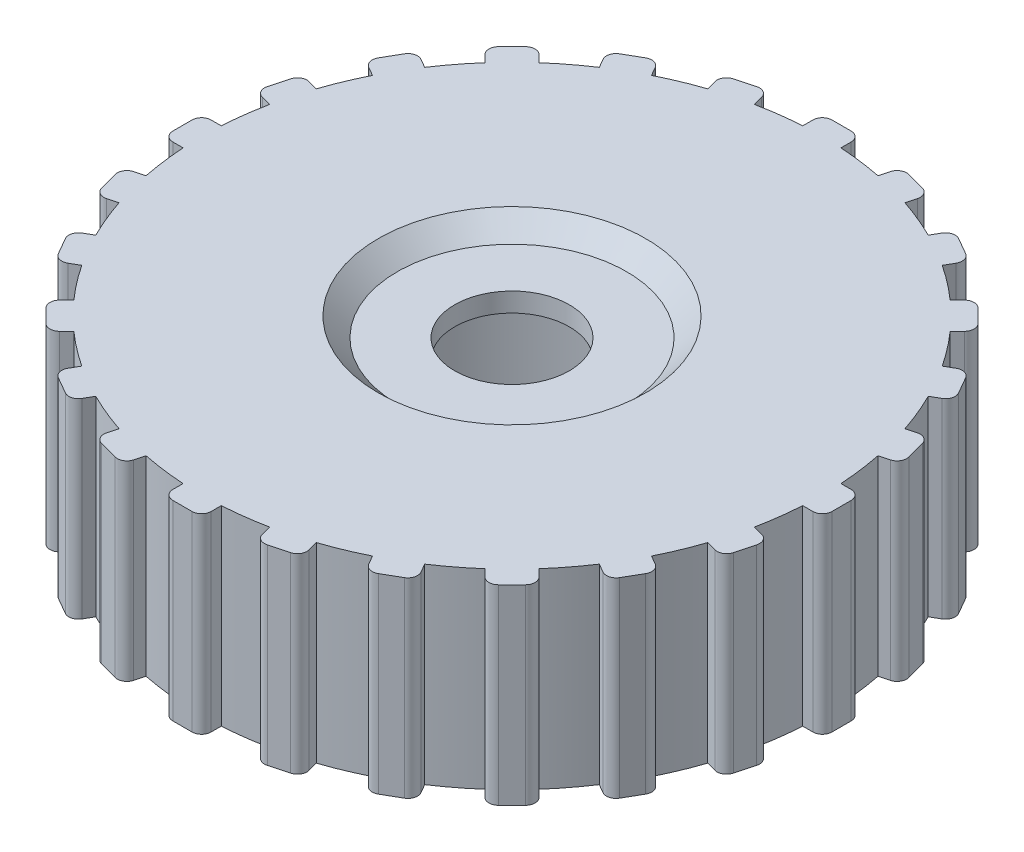
from build123d import *

# Parameters (mm, degrees)
SKETCH1_R           = 32.5
SKETCH1_R_2         = 18.5
BOSS_EXTRUDE1_DEPTH = 20
BOSS_EXTRUDE3_START = -20
BOSS_EXTRUDE3_DEPTH = 20
BOSS_EXTRUDE5_START = -20
BOSS_EXTRUDE5_DEPTH = 20
BOSS_EXTRUDE6_START = -4
SKETCH5_R           = 18.5
BOSS_EXTRUDE6_DEPTH = 4
SKETCH6_R           = 6
CUT_EXTRUDE1_DEPTH  = 4
SKETCH7_R           = 12
CUT_EXTRUDE2_DEPTH  = 2
CHAMFER1_SIZE       = 2


# Read off the part's stored shape, not the designer's step: Boss-Extrude5
with BuildPart() as part:
    # Sketch1 → Boss-Extrude1 (new body)
    with BuildSketch(Plane(origin=(0, 0, 0), x_dir=(1, 0, 0), z_dir=(0, 1, 0))):
        with Locations(Location((0, 0, 0), (0, 0, 270))):
            Circle(SKETCH1_R)
        with Locations(Location((0, 0, 0), (0, 0, 270))):
            Circle(SKETCH1_R_2, mode=Mode.SUBTRACT)
    extrude(amount=BOSS_EXTRUDE1_DEPTH)

    # Sketch3 → Boss-Extrude3 (add)
    with BuildSketch(Plane(origin=(0, 20, 0), x_dir=(1, 0, 0), z_dir=(0, 1, 0)).offset(BOSS_EXTRUDE3_START)):
        with BuildLine():
            ThreePointArc((1, 34.5), (1.707106781, 34.207106781), (2, 33.5))
            Line((2, 33.5), (2, 32.5))
            Line((2, 32.5), (0, 32.5))
            Line((0, 32.5), (-2, 32.5))
            Line((-2, 32.5), (-2, 33.5))
            ThreePointArc((-2, 33.5), (-1.707106781, 34.207106781), (-1, 34.5))
            Line((-1, 34.5), (1, 34.5))
        make_face()
        with BuildLine():
            ThreePointArc((2, 32.438403167), (1.000474159, 32.484597142), (0, 32.5))
            ThreePointArc((0, 32.5), (-1.000474159, 32.484597142), (-2, 32.438403167))
            Line((-2, 32.438403167), (-2, 31.779798794))
            Line((-2, 31.779798794), (2, 31.779798794))
            Line((2, 31.779798794), (2, 32.438403167))
        make_face()
        with BuildLine():
            Line((-6.293365525, 31.214566499), (-6.46382488, 31.850729472))
            ThreePointArc((-6.46382488, 31.850729472), (-7.441248584, 31.636653102), (-8.411618966, 31.392589354))
            ThreePointArc((-8.411618966, 31.392589354), (-9.374016241, 31.118769569), (-10.327528185, 30.815453292))
            Line((-10.327528185, 30.815453292), (-10.15706883, 30.179290319))
            Line((-10.15706883, 30.179290319), (-6.293365525, 31.214566499))
        make_face()
        with BuildLine():
            Line((-9.895182882, 33.065621962), (-7.96333123, 33.583260052))
            ThreePointArc((-7.96333123, 33.583260052), (-7.204512185, 33.48335963), (-6.738586358, 32.876153271))
            Line((-6.738586358, 32.876153271), (-6.479767313, 31.910227445))
            Line((-6.479767313, 31.910227445), (-8.411618966, 31.392589354))
            Line((-8.411618966, 31.392589354), (-10.343470618, 30.874951264))
            Line((-10.343470618, 30.874951264), (-10.602289664, 31.84087709))
            ThreePointArc((-10.602289664, 31.84087709), (-10.502389241, 32.599696136), (-9.895182882, 33.065621962))
        make_face()
        with BuildLine():
            ThreePointArc((8.411618966, 31.392589354), (7.441248584, 31.636653102), (6.46382488, 31.850729472))
            Line((6.46382488, 31.850729472), (6.293365525, 31.214566499))
            Line((6.293365525, 31.214566499), (10.15706883, 30.179290319))
            Line((10.15706883, 30.179290319), (10.327528185, 30.815453292))
            ThreePointArc((10.327528185, 30.815453292), (9.374016241, 31.118769569), (8.411618966, 31.392589354))
        make_face()
        with BuildLine():
            Line((7.96333123, 33.583260052), (9.895182882, 33.065621962))
            ThreePointArc((9.895182882, 33.065621962), (10.502389241, 32.599696136), (10.602289664, 31.84087709))
            Line((10.602289664, 31.84087709), (10.343470618, 30.874951264))
            Line((10.343470618, 30.874951264), (8.411618966, 31.392589354))
            Line((8.411618966, 31.392589354), (6.479767313, 31.910227445))
            Line((6.479767313, 31.910227445), (6.738586358, 32.876153271))
            ThreePointArc((6.738586358, 32.876153271), (7.204512185, 33.48335963), (7.96333123, 33.583260052))
        make_face()
        with BuildLine():
            ThreePointArc((16.25, 28.145825623), (15.375862533, 28.632723436), (14.487150776, 29.0924812))
            Line((14.487150776, 29.0924812), (14.157848589, 28.522113082))
            Line((14.157848589, 28.522113082), (17.621950204, 26.522113082))
            Line((17.621950204, 26.522113082), (17.951252391, 27.0924812))
            ThreePointArc((17.951252391, 27.0924812), (17.108734608, 27.632249277), (16.25, 28.145825623))
        make_face()
        with BuildLine():
            Line((16.383974596, 30.377876431), (18.116025404, 29.377876431))
            ThreePointArc((18.116025404, 29.377876431), (18.58195123, 28.770670072), (18.482050808, 28.011851027))
            Line((18.482050808, 28.011851027), (17.982050808, 27.145825623))
            Line((17.982050808, 27.145825623), (16.25, 28.145825623))
            Line((16.25, 28.145825623), (14.517949192, 29.145825623))
            Line((14.517949192, 29.145825623), (15.017949192, 30.011851027))
            ThreePointArc((15.017949192, 30.011851027), (15.625155551, 30.477776853), (16.383974596, 30.377876431))
        make_face()
        with BuildLine():
            ThreePointArc((22.980970389, 22.980970389), (22.262636861, 23.677520985), (21.523201288, 24.351628412))
            Line((21.523201288, 24.351628412), (21.057497669, 23.885924794))
            Line((21.057497669, 23.885924794), (23.885924794, 21.057497669))
            Line((23.885924794, 21.057497669), (24.351628412, 21.523201288))
            ThreePointArc((24.351628412, 21.523201288), (23.677520985, 22.262636861), (22.980970389, 22.980970389))
        make_face()
        with BuildLine():
            Line((23.68807717, 25.102290732), (25.102290732, 23.68807717))
            ThreePointArc((25.102290732, 23.68807717), (25.395183951, 22.980970389), (25.102290732, 22.273863607))
            Line((25.102290732, 22.273863607), (24.395183951, 21.566756826))
            Line((24.395183951, 21.566756826), (22.980970389, 22.980970389))
            Line((22.980970389, 22.980970389), (21.566756826, 24.395183951))
            Line((21.566756826, 24.395183951), (22.273863607, 25.102290732))
            ThreePointArc((22.273863607, 25.102290732), (22.980970389, 25.395183951), (23.68807717, 25.102290732))
        make_face()
        with BuildLine():
            Line((-14.157848589, 28.522113082), (-14.487150776, 29.0924812))
            ThreePointArc((-14.487150776, 29.0924812), (-15.375862533, 28.632723436), (-16.25, 28.145825623))
            ThreePointArc((-16.25, 28.145825623), (-17.108734608, 27.632249277), (-17.951252391, 27.0924812))
            Line((-17.951252391, 27.0924812), (-17.621950204, 26.522113082))
            Line((-17.621950204, 26.522113082), (-14.157848589, 28.522113082))
        make_face()
        with BuildLine():
            Line((-18.116025404, 29.377876431), (-16.383974596, 30.377876431))
            ThreePointArc((-16.383974596, 30.377876431), (-15.625155551, 30.477776853), (-15.017949192, 30.011851027))
            Line((-15.017949192, 30.011851027), (-14.517949192, 29.145825623))
            Line((-14.517949192, 29.145825623), (-16.25, 28.145825623))
            Line((-16.25, 28.145825623), (-17.982050808, 27.145825623))
            Line((-17.982050808, 27.145825623), (-18.482050808, 28.011851027))
            ThreePointArc((-18.482050808, 28.011851027), (-18.58195123, 28.770670072), (-18.116025404, 29.377876431))
        make_face()
        with BuildLine():
            Line((-21.057497669, 23.885924794), (-21.523201288, 24.351628412))
            ThreePointArc((-21.523201288, 24.351628412), (-22.262636861, 23.677520985), (-22.980970389, 22.980970389))
            ThreePointArc((-22.980970389, 22.980970389), (-23.677520985, 22.262636861), (-24.351628412, 21.523201288))
            Line((-24.351628412, 21.523201288), (-23.885924794, 21.057497669))
            Line((-23.885924794, 21.057497669), (-21.057497669, 23.885924794))
        make_face()
        with BuildLine():
            Line((-25.102290732, 23.68807717), (-23.68807717, 25.102290732))
            ThreePointArc((-23.68807717, 25.102290732), (-22.980970389, 25.395183951), (-22.273863607, 25.102290732))
            Line((-22.273863607, 25.102290732), (-21.566756826, 24.395183951))
            Line((-21.566756826, 24.395183951), (-22.980970389, 22.980970389))
            Line((-22.980970389, 22.980970389), (-24.395183951, 21.566756826))
            Line((-24.395183951, 21.566756826), (-25.102290732, 22.273863607))
            ThreePointArc((-25.102290732, 22.273863607), (-25.395183951, 22.980970389), (-25.102290732, 23.68807717))
        make_face()
        with BuildLine():
            Line((-26.522113082, 17.621950204), (-27.0924812, 17.951252391))
            ThreePointArc((-27.0924812, 17.951252391), (-27.632249277, 17.108734608), (-28.145825623, 16.25))
            ThreePointArc((-28.145825623, 16.25), (-28.632723436, 15.375862533), (-29.0924812, 14.487150776))
            Line((-29.0924812, 14.487150776), (-28.522113082, 14.157848589))
            Line((-28.522113082, 14.157848589), (-26.522113082, 17.621950204))
        make_face()
        with BuildLine():
            Line((-30.377876431, 16.383974596), (-29.377876431, 18.116025404))
            ThreePointArc((-29.377876431, 18.116025404), (-28.770670072, 18.58195123), (-28.011851027, 18.482050808))
            Line((-28.011851027, 18.482050808), (-27.145825623, 17.982050808))
            Line((-27.145825623, 17.982050808), (-28.145825623, 16.25))
            Line((-28.145825623, 16.25), (-29.145825623, 14.517949192))
            Line((-29.145825623, 14.517949192), (-30.011851027, 15.017949192))
            ThreePointArc((-30.011851027, 15.017949192), (-30.477776853, 15.625155551), (-30.377876431, 16.383974596))
        make_face()
        with BuildLine():
            Line((-30.179290319, 10.15706883), (-30.815453292, 10.327528185))
            ThreePointArc((-30.815453292, 10.327528185), (-31.118769569, 9.374016241), (-31.392589354, 8.411618966))
            ThreePointArc((-31.392589354, 8.411618966), (-31.636653102, 7.441248584), (-31.850729472, 6.46382488))
            Line((-31.850729472, 6.46382488), (-31.214566499, 6.293365525))
            Line((-31.214566499, 6.293365525), (-30.179290319, 10.15706883))
        make_face()
        with BuildLine():
            Line((-33.583260052, 7.96333123), (-33.065621962, 9.895182882))
            ThreePointArc((-33.065621962, 9.895182882), (-32.599696136, 10.502389241), (-31.84087709, 10.602289664))
            Line((-31.84087709, 10.602289664), (-30.874951264, 10.343470618))
            Line((-30.874951264, 10.343470618), (-31.392589354, 8.411618966))
            Line((-31.392589354, 8.411618966), (-31.910227445, 6.479767313))
            Line((-31.910227445, 6.479767313), (-32.876153271, 6.738586358))
            ThreePointArc((-32.876153271, 6.738586358), (-33.48335963, 7.204512185), (-33.583260052, 7.96333123))
        make_face()
        with BuildLine():
            Line((-34.5, -1), (-34.5, 1))
            ThreePointArc((-34.5, 1), (-34.207106781, 1.707106781), (-33.5, 2))
            Line((-33.5, 2), (-32.5, 2))
            Line((-32.5, 2), (-32.5, 0))
            Line((-32.5, 0), (-32.5, -2))
            Line((-32.5, -2), (-33.5, -2))
            ThreePointArc((-33.5, -2), (-34.207106781, -1.707106781), (-34.5, -1))
        make_face()
        with BuildLine():
            Line((-31.779798794, 2), (-32.438403167, 2))
            ThreePointArc((-32.438403167, 2), (-32.484597142, 1.000474159), (-32.5, 0))
            ThreePointArc((-32.5, 0), (-32.484597142, -1.000474159), (-32.438403167, -2))
            Line((-32.438403167, -2), (-31.779798794, -2))
            Line((-31.779798794, -2), (-31.779798794, 2))
        make_face()
        with BuildLine():
            Line((-33.065621962, -9.895182882), (-33.583260052, -7.96333123))
            ThreePointArc((-33.583260052, -7.96333123), (-33.48335963, -7.204512185), (-32.876153271, -6.738586358))
            Line((-32.876153271, -6.738586358), (-31.910227445, -6.479767313))
            Line((-31.910227445, -6.479767313), (-31.392589354, -8.411618966))
            Line((-31.392589354, -8.411618966), (-30.874951264, -10.343470618))
            Line((-30.874951264, -10.343470618), (-31.84087709, -10.602289664))
            ThreePointArc((-31.84087709, -10.602289664), (-32.599696136, -10.502389241), (-33.065621962, -9.895182882))
        make_face()
        with BuildLine():
            Line((-31.214566499, -6.293365525), (-31.850729472, -6.46382488))
            ThreePointArc((-31.850729472, -6.46382488), (-31.636653102, -7.441248584), (-31.392589354, -8.411618966))
            ThreePointArc((-31.392589354, -8.411618966), (-31.118769569, -9.374016241), (-30.815453292, -10.327528185))
            Line((-30.815453292, -10.327528185), (-30.179290319, -10.15706883))
            Line((-30.179290319, -10.15706883), (-31.214566499, -6.293365525))
        make_face()
        with BuildLine():
            Line((-29.377876431, -18.116025404), (-30.377876431, -16.383974596))
            ThreePointArc((-30.377876431, -16.383974596), (-30.477776853, -15.625155551), (-30.011851027, -15.017949192))
            Line((-30.011851027, -15.017949192), (-29.145825623, -14.517949192))
            Line((-29.145825623, -14.517949192), (-28.145825623, -16.25))
            Line((-28.145825623, -16.25), (-27.145825623, -17.982050808))
            Line((-27.145825623, -17.982050808), (-28.011851027, -18.482050808))
            ThreePointArc((-28.011851027, -18.482050808), (-28.770670072, -18.58195123), (-29.377876431, -18.116025404))
        make_face()
        with BuildLine():
            Line((-28.522113082, -14.157848589), (-29.0924812, -14.487150776))
            ThreePointArc((-29.0924812, -14.487150776), (-28.632723436, -15.375862533), (-28.145825623, -16.25))
            ThreePointArc((-28.145825623, -16.25), (-27.632249277, -17.108734608), (-27.0924812, -17.951252391))
            Line((-27.0924812, -17.951252391), (-26.522113082, -17.621950204))
            Line((-26.522113082, -17.621950204), (-28.522113082, -14.157848589))
        make_face()
        with BuildLine():
            Line((-23.68807717, -25.102290732), (-25.102290732, -23.68807717))
            ThreePointArc((-25.102290732, -23.68807717), (-25.395183951, -22.980970389), (-25.102290732, -22.273863607))
            Line((-25.102290732, -22.273863607), (-24.395183951, -21.566756826))
            Line((-24.395183951, -21.566756826), (-22.980970389, -22.980970389))
            Line((-22.980970389, -22.980970389), (-21.566756826, -24.395183951))
            Line((-21.566756826, -24.395183951), (-22.273863607, -25.102290732))
            ThreePointArc((-22.273863607, -25.102290732), (-22.980970389, -25.395183951), (-23.68807717, -25.102290732))
        make_face()
        with BuildLine():
            Line((-23.885924794, -21.057497669), (-24.351628412, -21.523201288))
            ThreePointArc((-24.351628412, -21.523201288), (-23.677520985, -22.262636861), (-22.980970389, -22.980970389))
            ThreePointArc((-22.980970389, -22.980970389), (-22.262636861, -23.677520985), (-21.523201288, -24.351628412))
            Line((-21.523201288, -24.351628412), (-21.057497669, -23.885924794))
            Line((-21.057497669, -23.885924794), (-23.885924794, -21.057497669))
        make_face()
        with BuildLine():
            Line((-16.383974596, -30.377876431), (-18.116025404, -29.377876431))
            ThreePointArc((-18.116025404, -29.377876431), (-18.58195123, -28.770670072), (-18.482050808, -28.011851027))
            Line((-18.482050808, -28.011851027), (-17.982050808, -27.145825623))
            Line((-17.982050808, -27.145825623), (-16.25, -28.145825623))
            Line((-16.25, -28.145825623), (-14.517949192, -29.145825623))
            Line((-14.517949192, -29.145825623), (-15.017949192, -30.011851027))
            ThreePointArc((-15.017949192, -30.011851027), (-15.625155551, -30.477776853), (-16.383974596, -30.377876431))
        make_face()
        with BuildLine():
            Line((-17.621950204, -26.522113082), (-17.951252391, -27.0924812))
            ThreePointArc((-17.951252391, -27.0924812), (-17.108734608, -27.632249277), (-16.25, -28.145825623))
            ThreePointArc((-16.25, -28.145825623), (-15.375862533, -28.632723436), (-14.487150776, -29.0924812))
            Line((-14.487150776, -29.0924812), (-14.157848589, -28.522113082))
            Line((-14.157848589, -28.522113082), (-17.621950204, -26.522113082))
        make_face()
        with BuildLine():
            Line((-10.15706883, -30.179290319), (-10.327528185, -30.815453292))
            ThreePointArc((-10.327528185, -30.815453292), (-9.374016241, -31.118769569), (-8.411618966, -31.392589354))
            ThreePointArc((-8.411618966, -31.392589354), (-7.441248584, -31.636653102), (-6.46382488, -31.850729472))
            Line((-6.46382488, -31.850729472), (-6.293365525, -31.214566499))
            Line((-6.293365525, -31.214566499), (-10.15706883, -30.179290319))
        make_face()
        with BuildLine():
            Line((1, -34.5), (-1, -34.5))
            ThreePointArc((-1, -34.5), (-1.707106781, -34.207106781), (-2, -33.5))
            Line((-2, -33.5), (-2, -32.5))
            Line((-2, -32.5), (0, -32.5))
            Line((0, -32.5), (2, -32.5))
            Line((2, -32.5), (2, -33.5))
            ThreePointArc((2, -33.5), (1.707106781, -34.207106781), (1, -34.5))
        make_face()
        with BuildLine():
            ThreePointArc((0, -32.5), (1.000474159, -32.484597142), (2, -32.438403167))
            Line((2, -32.438403167), (2, -31.779798794))
            Line((2, -31.779798794), (-2, -31.779798794))
            Line((-2, -31.779798794), (-2, -32.438403167))
            ThreePointArc((-2, -32.438403167), (-1.000474159, -32.484597142), (0, -32.5))
        make_face()
        with BuildLine():
            Line((9.895182882, -33.065621962), (7.96333123, -33.583260052))
            ThreePointArc((7.96333123, -33.583260052), (7.204512185, -33.48335963), (6.738586358, -32.876153271))
            Line((6.738586358, -32.876153271), (6.479767313, -31.910227445))
            Line((6.479767313, -31.910227445), (8.411618966, -31.392589354))
            Line((8.411618966, -31.392589354), (10.343470618, -30.874951264))
            Line((10.343470618, -30.874951264), (10.602289664, -31.84087709))
            ThreePointArc((10.602289664, -31.84087709), (10.502389241, -32.599696136), (9.895182882, -33.065621962))
        make_face()
        with BuildLine():
            ThreePointArc((8.411618966, -31.392589354), (9.374016241, -31.118769569), (10.327528185, -30.815453292))
            Line((10.327528185, -30.815453292), (10.15706883, -30.179290319))
            Line((10.15706883, -30.179290319), (6.293365525, -31.214566499))
            Line((6.293365525, -31.214566499), (6.46382488, -31.850729472))
            ThreePointArc((6.46382488, -31.850729472), (7.441248584, -31.636653102), (8.411618966, -31.392589354))
        make_face()
        with BuildLine():
            Line((18.116025404, -29.377876431), (16.383974596, -30.377876431))
            ThreePointArc((16.383974596, -30.377876431), (15.625155551, -30.477776853), (15.017949192, -30.011851027))
            Line((15.017949192, -30.011851027), (14.517949192, -29.145825623))
            Line((14.517949192, -29.145825623), (16.25, -28.145825623))
            Line((16.25, -28.145825623), (17.982050808, -27.145825623))
            Line((17.982050808, -27.145825623), (18.482050808, -28.011851027))
            ThreePointArc((18.482050808, -28.011851027), (18.58195123, -28.770670072), (18.116025404, -29.377876431))
        make_face()
        with BuildLine():
            ThreePointArc((16.25, -28.145825623), (17.108734608, -27.632249277), (17.951252391, -27.0924812))
            Line((17.951252391, -27.0924812), (17.621950204, -26.522113082))
            Line((17.621950204, -26.522113082), (14.157848589, -28.522113082))
            Line((14.157848589, -28.522113082), (14.487150776, -29.0924812))
            ThreePointArc((14.487150776, -29.0924812), (15.375862533, -28.632723436), (16.25, -28.145825623))
        make_face()
        with BuildLine():
            Line((25.102290732, -23.68807717), (23.68807717, -25.102290732))
            ThreePointArc((23.68807717, -25.102290732), (22.980970389, -25.395183951), (22.273863607, -25.102290732))
            Line((22.273863607, -25.102290732), (21.566756826, -24.395183951))
            Line((21.566756826, -24.395183951), (22.980970389, -22.980970389))
            Line((22.980970389, -22.980970389), (24.395183951, -21.566756826))
            Line((24.395183951, -21.566756826), (25.102290732, -22.273863607))
            ThreePointArc((25.102290732, -22.273863607), (25.395183951, -22.980970389), (25.102290732, -23.68807717))
        make_face()
        with BuildLine():
            ThreePointArc((22.980970389, -22.980970389), (23.677520985, -22.262636861), (24.351628412, -21.523201288))
            Line((24.351628412, -21.523201288), (23.885924794, -21.057497669))
            Line((23.885924794, -21.057497669), (21.057497669, -23.885924794))
            Line((21.057497669, -23.885924794), (21.523201288, -24.351628412))
            ThreePointArc((21.523201288, -24.351628412), (22.262636861, -23.677520985), (22.980970389, -22.980970389))
        make_face()
        with BuildLine():
            Line((30.377876431, -16.383974596), (29.377876431, -18.116025404))
            ThreePointArc((29.377876431, -18.116025404), (28.770670072, -18.58195123), (28.011851027, -18.482050808))
            Line((28.011851027, -18.482050808), (27.145825623, -17.982050808))
            Line((27.145825623, -17.982050808), (28.145825623, -16.25))
            Line((28.145825623, -16.25), (29.145825623, -14.517949192))
            Line((29.145825623, -14.517949192), (30.011851027, -15.017949192))
            ThreePointArc((30.011851027, -15.017949192), (30.477776853, -15.625155551), (30.377876431, -16.383974596))
        make_face()
        with BuildLine():
            ThreePointArc((28.145825623, -16.25), (28.632723436, -15.375862533), (29.0924812, -14.487150776))
            Line((29.0924812, -14.487150776), (28.522113082, -14.157848589))
            Line((28.522113082, -14.157848589), (26.522113082, -17.621950204))
            Line((26.522113082, -17.621950204), (27.0924812, -17.951252391))
            ThreePointArc((27.0924812, -17.951252391), (27.632249277, -17.108734608), (28.145825623, -16.25))
        make_face()
        with BuildLine():
            Line((33.583260052, -7.96333123), (33.065621962, -9.895182882))
            ThreePointArc((33.065621962, -9.895182882), (32.599696136, -10.502389241), (31.84087709, -10.602289664))
            Line((31.84087709, -10.602289664), (30.874951264, -10.343470618))
            Line((30.874951264, -10.343470618), (31.392589354, -8.411618966))
            Line((31.392589354, -8.411618966), (31.910227445, -6.479767313))
            Line((31.910227445, -6.479767313), (32.876153271, -6.738586358))
            ThreePointArc((32.876153271, -6.738586358), (33.48335963, -7.204512185), (33.583260052, -7.96333123))
        make_face()
        with BuildLine():
            ThreePointArc((31.392589354, -8.411618966), (31.636653102, -7.441248584), (31.850729472, -6.46382488))
            Line((31.850729472, -6.46382488), (31.214566499, -6.293365525))
            Line((31.214566499, -6.293365525), (30.179290319, -10.15706883))
            Line((30.179290319, -10.15706883), (30.815453292, -10.327528185))
            ThreePointArc((30.815453292, -10.327528185), (31.118769569, -9.374016241), (31.392589354, -8.411618966))
        make_face()
        with BuildLine():
            Line((34.5, 1), (34.5, -1))
            ThreePointArc((34.5, -1), (34.207106781, -1.707106781), (33.5, -2))
            Line((33.5, -2), (32.5, -2))
            Line((32.5, -2), (32.5, 0))
            Line((32.5, 0), (32.5, 2))
            Line((32.5, 2), (33.5, 2))
            ThreePointArc((33.5, 2), (34.207106781, 1.707106781), (34.5, 1))
        make_face()
        with BuildLine():
            ThreePointArc((32.5, 0), (32.484597142, 1.000474159), (32.438403167, 2))
            Line((32.438403167, 2), (31.779798794, 2))
            Line((31.779798794, 2), (31.779798794, -2))
            Line((31.779798794, -2), (32.438403167, -2))
            ThreePointArc((32.438403167, -2), (32.484597142, -1.000474159), (32.5, 0))
        make_face()
        with BuildLine():
            Line((33.065621962, 9.895182882), (33.583260052, 7.96333123))
            ThreePointArc((33.583260052, 7.96333123), (33.48335963, 7.204512185), (32.876153271, 6.738586358))
            Line((32.876153271, 6.738586358), (31.910227445, 6.479767313))
            Line((31.910227445, 6.479767313), (31.392589354, 8.411618966))
            Line((31.392589354, 8.411618966), (30.874951264, 10.343470618))
            Line((30.874951264, 10.343470618), (31.84087709, 10.602289664))
            ThreePointArc((31.84087709, 10.602289664), (32.599696136, 10.502389241), (33.065621962, 9.895182882))
        make_face()
        with BuildLine():
            ThreePointArc((31.392589354, 8.411618966), (31.118769569, 9.374016241), (30.815453292, 10.327528185))
            Line((30.815453292, 10.327528185), (30.179290319, 10.15706883))
            Line((30.179290319, 10.15706883), (31.214566499, 6.293365525))
            Line((31.214566499, 6.293365525), (31.850729472, 6.46382488))
            ThreePointArc((31.850729472, 6.46382488), (31.636653102, 7.441248584), (31.392589354, 8.411618966))
        make_face()
        with BuildLine():
            Line((29.377876431, 18.116025404), (30.377876431, 16.383974596))
            ThreePointArc((30.377876431, 16.383974596), (30.477776853, 15.625155551), (30.011851027, 15.017949192))
            Line((30.011851027, 15.017949192), (29.145825623, 14.517949192))
            Line((29.145825623, 14.517949192), (28.145825623, 16.25))
            Line((28.145825623, 16.25), (27.145825623, 17.982050808))
            Line((27.145825623, 17.982050808), (28.011851027, 18.482050808))
            ThreePointArc((28.011851027, 18.482050808), (28.770670072, 18.58195123), (29.377876431, 18.116025404))
        make_face()
        with BuildLine():
            ThreePointArc((28.145825623, 16.25), (27.632249277, 17.108734608), (27.0924812, 17.951252391))
            Line((27.0924812, 17.951252391), (26.522113082, 17.621950204))
            Line((26.522113082, 17.621950204), (28.522113082, 14.157848589))
            Line((28.522113082, 14.157848589), (29.0924812, 14.487150776))
            ThreePointArc((29.0924812, 14.487150776), (28.632723436, 15.375862533), (28.145825623, 16.25))
        make_face()
        with BuildLine():
            Line((-7.96333123, -33.583260052), (-9.895182882, -33.065621962))
            ThreePointArc((-9.895182882, -33.065621962), (-10.502389241, -32.599696136), (-10.602289664, -31.84087709))
            Line((-10.602289664, -31.84087709), (-10.343470618, -30.874951264))
            Line((-10.343470618, -30.874951264), (-8.411618966, -31.392589354))
            Line((-8.411618966, -31.392589354), (-6.479767313, -31.910227445))
            Line((-6.479767313, -31.910227445), (-6.738586358, -32.876153271))
            ThreePointArc((-6.738586358, -32.876153271), (-7.204512185, -33.48335963), (-7.96333123, -33.583260052))
        make_face()
    extrude(amount=BOSS_EXTRUDE3_DEPTH)

    # Boss-Extrude5 outline → Boss-Extrude5 (add)
    with BuildSketch(Plane(origin=(0, 20, 0), x_dir=(1, 0, 0), z_dir=(0, 1, 0)).offset(BOSS_EXTRUDE5_START)):
        with BuildLine():
            Line((32.5, -2), (32.5, 0))
            ThreePointArc((32.5, 0), (32.484597142, -1.000474159), (32.438403167, -2))
            Line((32.438403167, -2), (32.5, -2))
        make_face()
        with BuildLine():
            ThreePointArc((32.438403167, 2), (32.484597142, 1.000474159), (32.5, 0))
            Line((32.5, 0), (32.5, 2))
            Line((32.5, 2), (32.438403167, 2))
        make_face()
        with BuildLine():
            ThreePointArc((31.392589406, 8.411618773), (31.636653125, 7.441248487), (31.850729472, 6.46382488))
            Line((31.850729472, 6.46382488), (31.910227445, 6.479767314))
            Line((31.910227445, 6.479767314), (31.392589406, 8.411618773))
        make_face()
        with BuildLine():
            Line((31.910227445, -6.479767314), (31.850729472, -6.46382488))
            ThreePointArc((31.850729472, -6.46382488), (31.636653096, -7.44124861), (31.392589341, -8.411619017))
            Line((31.392589341, -8.411619017), (31.910227445, -6.479767314))
        make_face()
        with BuildLine():
            ThreePointArc((30.815453292, 10.327528185), (31.118769598, 9.374016146), (31.392589406, 8.411618773))
            Line((31.392589406, 8.411618773), (30.874951264, 10.343470618))
            Line((30.874951264, 10.343470618), (30.815453292, 10.327528185))
        make_face()
        with BuildLine():
            Line((30.874951264, -10.343470618), (31.392589341, -8.411619017))
            ThreePointArc((31.392589341, -8.411619017), (31.118769562, -9.374016267), (30.815453292, -10.327528185))
            Line((30.815453292, -10.327528185), (30.874951264, -10.343470618))
        make_face()
        with BuildLine():
            ThreePointArc((28.145825549, 16.250000127), (28.632723401, 15.375862598), (29.0924812, 14.487150776))
            Line((29.0924812, 14.487150776), (29.145825623, 14.517949193))
            Line((29.145825623, 14.517949193), (28.145825549, 16.250000127))
        make_face()
        with BuildLine():
            Line((29.145825623, -14.517949193), (29.0924812, -14.487150776))
            ThreePointArc((29.0924812, -14.487150776), (28.632723353, -15.375862687), (28.145825449, -16.250000301))
            Line((28.145825449, -16.250000301), (29.145825623, -14.517949193))
        make_face()
        with BuildLine():
            ThreePointArc((27.0924812, 17.951252391), (27.632249238, 17.108734671), (28.145825549, 16.250000127))
            Line((28.145825549, 16.250000127), (27.145825623, 17.982050808))
            Line((27.145825623, 17.982050808), (27.0924812, 17.951252391))
        make_face()
        with BuildLine():
            Line((27.145825623, -17.982050808), (28.145825449, -16.250000301))
            ThreePointArc((28.145825449, -16.250000301), (27.632249185, -17.108734756), (27.0924812, -17.951252391))
            Line((27.0924812, -17.951252391), (27.145825623, -17.982050808))
        make_face()
        with BuildLine():
            ThreePointArc((22.980970389, 22.980970388), (23.677520985, 22.262636861), (24.351628412, 21.523201288))
            Line((24.351628412, 21.523201288), (24.395183951, 21.566756826))
            Line((24.395183951, 21.566756826), (22.980970389, 22.980970388))
        make_face()
        with BuildLine():
            Line((24.395183951, -21.566756826), (24.351628412, -21.523201288))
            ThreePointArc((24.351628412, -21.523201288), (23.677520985, -22.262636861), (22.980970388, -22.980970389))
            Line((22.980970388, -22.980970389), (24.395183951, -21.566756826))
        make_face()
        with BuildLine():
            ThreePointArc((21.523201288, 24.351628412), (22.262636861, 23.677520985), (22.980970389, 22.980970388))
            Line((22.980970389, 22.980970388), (21.566756826, 24.395183951))
            Line((21.566756826, 24.395183951), (21.523201288, 24.351628412))
        make_face()
        with BuildLine():
            Line((21.566756826, -24.395183951), (22.980970388, -22.980970389))
            ThreePointArc((22.980970388, -22.980970389), (22.262636861, -23.677520985), (21.523201288, -24.351628412))
            Line((21.523201288, -24.351628412), (21.566756826, -24.395183951))
        make_face()
        with BuildLine():
            ThreePointArc((16.250000127, 28.145825549), (17.108734671, 27.632249238), (17.951252391, 27.0924812))
            Line((17.951252391, 27.0924812), (17.982050808, 27.145825623))
            Line((17.982050808, 27.145825623), (16.250000127, 28.145825549))
        make_face()
        with BuildLine():
            Line((17.982050808, -27.145825623), (17.951252391, -27.0924812))
            ThreePointArc((17.951252391, -27.0924812), (17.108734671, -27.632249238), (16.250000127, -28.145825549))
            Line((16.250000127, -28.145825549), (17.982050808, -27.145825623))
        make_face()
        with BuildLine():
            ThreePointArc((14.487150776, 29.0924812), (15.375862598, 28.632723401), (16.250000127, 28.145825549))
            Line((16.250000127, 28.145825549), (14.517949192, 29.145825623))
            Line((14.517949192, 29.145825623), (14.487150776, 29.0924812))
        make_face()
        with BuildLine():
            Line((14.517949192, -29.145825623), (16.250000127, -28.145825549))
            ThreePointArc((16.250000127, -28.145825549), (15.375862598, -28.632723401), (14.487150776, -29.0924812))
            Line((14.487150776, -29.0924812), (14.517949192, -29.145825623))
        make_face()
        with BuildLine():
            ThreePointArc((8.41161876, 31.39258941), (9.374016139, 31.1187696), (10.327528185, 30.815453292))
            Line((10.327528185, 30.815453292), (10.343470619, 30.874951264))
            Line((10.343470619, 30.874951264), (8.41161876, 31.39258941))
        make_face()
        with BuildLine():
            Line((10.343470619, -30.874951264), (10.327528185, -30.815453292))
            ThreePointArc((10.327528185, -30.815453292), (9.374016341, -31.118769539), (8.411619167, -31.3925893))
            Line((8.411619167, -31.3925893), (10.343470619, -30.874951264))
        make_face()
        with BuildLine():
            ThreePointArc((6.46382488, 31.850729472), (7.441248481, 31.636653127), (8.41161876, 31.39258941))
            Line((8.41161876, 31.39258941), (6.479767313, 31.910227445))
            Line((6.479767313, 31.910227445), (6.46382488, 31.850729472))
        make_face()
        with BuildLine():
            Line((6.479767313, -31.910227445), (8.411619167, -31.3925893))
            ThreePointArc((8.411619167, -31.3925893), (7.441248686, -31.636653078), (6.46382488, -31.850729472))
            Line((6.46382488, -31.850729472), (6.479767313, -31.910227445))
        make_face()
        with BuildLine():
            ThreePointArc((0, 32.5), (1.000474159, 32.484597142), (2, 32.438403167))
            Line((2, 32.438403167), (2, 32.5))
            Line((2, 32.5), (0, 32.5))
        make_face()
        with BuildLine():
            Line((2, -32.5), (2, -32.438403167))
            ThreePointArc((2, -32.438403167), (1.000474159, -32.484597142), (0, -32.5))
            Line((0, -32.5), (2, -32.5))
        make_face()
        with BuildLine():
            ThreePointArc((-2, 32.438403167), (-1.000474159, 32.484597142), (0, 32.5))
            Line((0, 32.5), (-2, 32.5))
            Line((-2, 32.5), (-2, 32.438403167))
        make_face()
        with BuildLine():
            Line((-2, -32.5), (0, -32.5))
            ThreePointArc((0, -32.5), (-1.000474159, -32.484597142), (-2, -32.438403167))
            Line((-2, -32.438403167), (-2, -32.5))
        make_face()
        with BuildLine():
            ThreePointArc((-8.411619167, 31.3925893), (-7.441248686, 31.636653078), (-6.46382488, 31.850729472))
            Line((-6.46382488, 31.850729472), (-6.479767314, 31.910227445))
            Line((-6.479767314, 31.910227445), (-8.411619167, 31.3925893))
        make_face()
        with BuildLine():
            Line((-6.479767314, -31.910227445), (-6.46382488, -31.850729472))
            ThreePointArc((-6.46382488, -31.850729472), (-7.441248686, -31.636653078), (-8.411619167, -31.3925893))
            Line((-8.411619167, -31.3925893), (-6.479767314, -31.910227445))
        make_face()
        with BuildLine():
            ThreePointArc((-10.327528185, 30.815453292), (-9.374016341, 31.118769539), (-8.411619167, 31.3925893))
            Line((-8.411619167, 31.3925893), (-10.343470618, 30.874951264))
            Line((-10.343470618, 30.874951264), (-10.327528185, 30.815453292))
        make_face()
        with BuildLine():
            Line((-10.343470618, -30.874951264), (-8.411619167, -31.3925893))
            ThreePointArc((-8.411619167, -31.3925893), (-9.374016341, -31.118769539), (-10.327528185, -30.815453292))
            Line((-10.327528185, -30.815453292), (-10.343470618, -30.874951264))
        make_face()
        with BuildLine():
            ThreePointArc((-16.250000127, 28.145825549), (-15.375862598, 28.632723401), (-14.487150776, 29.0924812))
            Line((-14.487150776, 29.0924812), (-14.517949193, 29.145825623))
            Line((-14.517949193, 29.145825623), (-16.250000127, 28.145825549))
        make_face()
        with BuildLine():
            Line((-14.517949193, -29.145825623), (-14.487150776, -29.0924812))
            ThreePointArc((-14.487150776, -29.0924812), (-15.375862598, -28.632723401), (-16.250000127, -28.145825549))
            Line((-16.250000127, -28.145825549), (-14.517949193, -29.145825623))
        make_face()
        with BuildLine():
            ThreePointArc((-17.951252391, 27.0924812), (-17.108734671, 27.632249238), (-16.250000127, 28.145825549))
            Line((-16.250000127, 28.145825549), (-17.982050808, 27.145825623))
            Line((-17.982050808, 27.145825623), (-17.951252391, 27.0924812))
        make_face()
        with BuildLine():
            Line((-17.982050808, -27.145825623), (-16.250000127, -28.145825549))
            ThreePointArc((-16.250000127, -28.145825549), (-17.108734671, -27.632249238), (-17.951252391, -27.0924812))
            Line((-17.951252391, -27.0924812), (-17.982050808, -27.145825623))
        make_face()
        with BuildLine():
            ThreePointArc((-22.980970388, 22.980970389), (-22.262636861, 23.677520985), (-21.523201288, 24.351628412))
            Line((-21.523201288, 24.351628412), (-21.566756826, 24.395183951))
            Line((-21.566756826, 24.395183951), (-22.980970388, 22.980970389))
        make_face()
        with BuildLine():
            Line((-21.566756826, -24.395183951), (-21.523201288, -24.351628412))
            ThreePointArc((-21.523201288, -24.351628412), (-22.262636861, -23.677520985), (-22.980970389, -22.980970388))
            Line((-22.980970389, -22.980970388), (-21.566756826, -24.395183951))
        make_face()
        with BuildLine():
            ThreePointArc((-24.351628412, 21.523201288), (-23.677520985, 22.262636861), (-22.980970388, 22.980970389))
            Line((-22.980970388, 22.980970389), (-24.395183951, 21.566756826))
            Line((-24.395183951, 21.566756826), (-24.351628412, 21.523201288))
        make_face()
        with BuildLine():
            Line((-24.395183951, -21.566756826), (-22.980970389, -22.980970388))
            ThreePointArc((-22.980970389, -22.980970388), (-23.677520985, -22.262636861), (-24.351628412, -21.523201288))
            Line((-24.351628412, -21.523201288), (-24.395183951, -21.566756826))
        make_face()
        with BuildLine():
            ThreePointArc((-28.145825681, 16.2499999), (-27.632249307, 17.108734559), (-27.0924812, 17.951252391))
            Line((-27.0924812, 17.951252391), (-27.145825623, 17.982050808))
            Line((-27.145825623, 17.982050808), (-28.145825681, 16.2499999))
        make_face()
        with BuildLine():
            Line((-27.145825623, -17.982050808), (-27.0924812, -17.951252391))
            ThreePointArc((-27.0924812, -17.951252391), (-27.632249238, -17.108734671), (-28.145825549, -16.250000127))
            Line((-28.145825549, -16.250000127), (-27.145825623, -17.982050808))
        make_face()
        with BuildLine():
            ThreePointArc((-29.0924812, 14.487150776), (-28.632723463, 15.375862483), (-28.145825681, 16.2499999))
            Line((-28.145825681, 16.2499999), (-29.145825623, 14.517949192))
            Line((-29.145825623, 14.517949192), (-29.0924812, 14.487150776))
        make_face()
        with BuildLine():
            Line((-29.145825623, -14.517949192), (-28.145825549, -16.250000127))
            ThreePointArc((-28.145825549, -16.250000127), (-28.632723401, -15.375862598), (-29.0924812, -14.487150776))
            Line((-29.0924812, -14.487150776), (-29.145825623, -14.517949192))
        make_face()
        with BuildLine():
            ThreePointArc((-31.3925893, 8.411619167), (-31.118769539, 9.374016341), (-30.815453292, 10.327528185))
            Line((-30.815453292, 10.327528185), (-30.874951264, 10.343470618))
            Line((-30.874951264, 10.343470618), (-31.3925893, 8.411619167))
        make_face()
        with BuildLine():
            Line((-30.874951264, -10.343470619), (-30.815453292, -10.327528185))
            ThreePointArc((-30.815453292, -10.327528185), (-31.118769539, -9.374016341), (-31.3925893, -8.411619167))
            Line((-31.3925893, -8.411619167), (-30.874951264, -10.343470619))
        make_face()
        with BuildLine():
            ThreePointArc((-31.850729472, 6.46382488), (-31.636653078, 7.441248686), (-31.3925893, 8.411619167))
            Line((-31.3925893, 8.411619167), (-31.910227445, 6.479767313))
            Line((-31.910227445, 6.479767313), (-31.850729472, 6.46382488))
        make_face()
        with BuildLine():
            Line((-31.910227445, -6.479767313), (-31.3925893, -8.411619167))
            ThreePointArc((-31.3925893, -8.411619167), (-31.636653078, -7.441248686), (-31.850729472, -6.46382488))
            Line((-31.850729472, -6.46382488), (-31.910227445, -6.479767313))
        make_face()
        with BuildLine():
            ThreePointArc((-32.5, 0), (-32.484597142, 1.000474159), (-32.438403167, 2))
            Line((-32.438403167, 2), (-32.5, 2))
            Line((-32.5, 2), (-32.5, 0))
        make_face()
        with BuildLine():
            Line((-32.5, -2), (-32.438403167, -2))
            ThreePointArc((-32.438403167, -2), (-32.484597142, -1.000474159), (-32.5, 0))
            Line((-32.5, 0), (-32.5, -2))
        make_face()
    extrude(amount=BOSS_EXTRUDE5_DEPTH)

    # Sketch5 → Boss-Extrude6 (add)
    with BuildSketch(Plane(origin=(0, 20, 0), x_dir=(1, 0, 0), z_dir=(0, 1, 0)).offset(BOSS_EXTRUDE6_START)):
        with Locations(Location((0, 0, 0), (0, 0, 270))):
            Circle(SKETCH5_R)
    extrude(amount=BOSS_EXTRUDE6_DEPTH)

    # Sketch6 → Cut-Extrude1 (cut)
    with BuildSketch(Plane(origin=(0, 20, 0), x_dir=(1, 0, 0), z_dir=(0, 1, 0))):
        with Locations(Location((0, 0, 0), (0, 0, 270))):
            Circle(SKETCH6_R)
    extrude(amount=-CUT_EXTRUDE1_DEPTH, mode=Mode.SUBTRACT)

    # Sketch7 → Cut-Extrude2 (cut)
    with BuildSketch(Plane(origin=(0, 20, 0), x_dir=(1, 0, 0), z_dir=(0, 1, 0))):
        with Locations(Location((0, 0, 0), (0, 0, 270))):
            Circle(SKETCH7_R)
    extrude(amount=-CUT_EXTRUDE2_DEPTH, mode=Mode.SUBTRACT)

    # Chamfer1
    chamfer1_edges = [part.edges().sort_by_distance(p)[0] for p in [
        (0, 20, -12),
    ]]
    chamfer(chamfer1_edges, length=CHAMFER1_SIZE - 0.0001)  # a hair under: the kernel refuses the full size


solid = part.part
